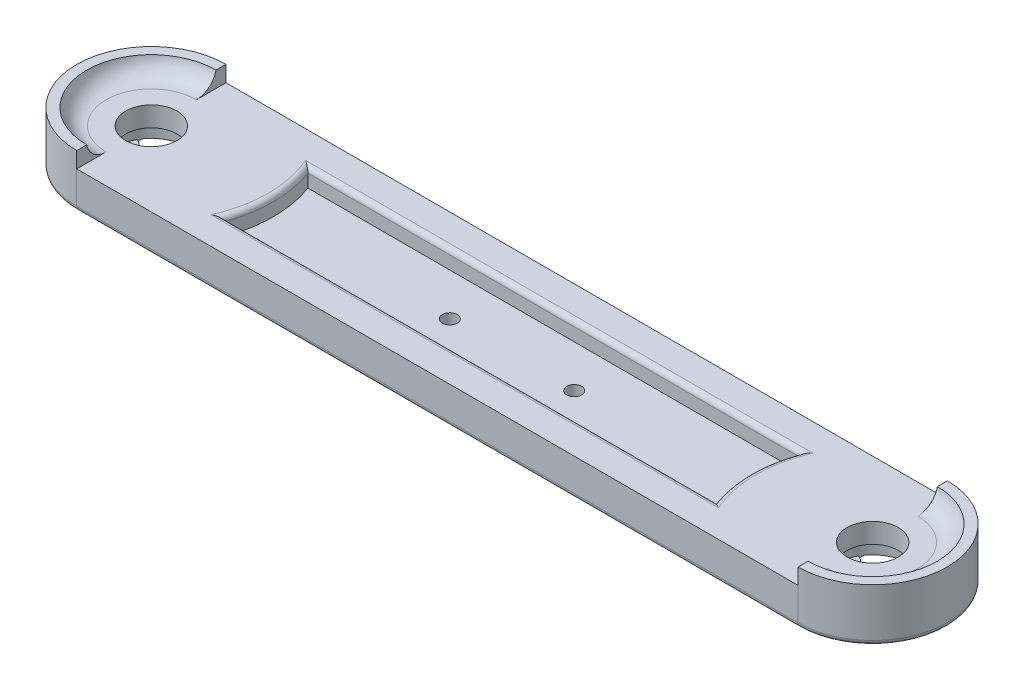
from build123d import *

# Parameters (mm, degrees)
CROQUIS1_R              = 15
CROQUIS1_R_2            = 5.15
SALIENTE_EXTRUIR1_DEPTH = 7.5
CROQUIS2_R              = 5.15
CORTAR_EXTRUIR1_DEPTH   = 3.5
SALIENTE_EXTRUIR6_DEPTH = 3.2
CROQUIS13_R             = 1.5
CORTAR_EXTRUIR2_DEPTH   = 3.6
REDONDEO1_R             = 4
REDONDEO2_R             = 1
REDONDEO3_R             = 1
SALIENTE_EXTRUIR7_START = 2
SALIENTE_EXTRUIR7_DEPTH = 2
REDONDEO5_R             = 1
CROQUIS13_2_R           = 1.5
CORTAR_EXTRUIR3_DEPTH   = 90.28325712


with BuildPart() as part:
    # Croquis1 → Saliente-Extruir1 (new body)
    # profile 1 of 3: a face of its own
    with BuildSketch(Plane(origin=(0, 0, 0), x_dir=(1, 0, 0), z_dir=(0, 1, 0))):
        with Locations((-72.5, 0)):
            Circle(CROQUIS1_R)
        with Locations(Location((-72.5, 0, 0), (0, 0, 270))):
            Circle(CROQUIS1_R_2, mode=Mode.SUBTRACT)
    # profile 2 of 3: a face of its own
    with BuildSketch(Plane(origin=(0, 0, 0), x_dir=(1, 0, 0), z_dir=(0, 1, 0))):
        with BuildLine():
            Line((72.5, 15), (-72.5, 15))
            ThreePointArc((-72.5, 15), (-61.893398282, 10.606601718), (-57.5, 0))
            ThreePointArc((-57.5, 0), (-61.893398282, -10.606601718), (-72.5, -15))
            Line((-72.5, -15), (72.5, -15))
            ThreePointArc((72.5, -15), (57.5, 0), (72.5, 15))
        make_face()
    # profile 3 of 3: a face of its own
    with BuildSketch(Plane(origin=(0, 0, 0), x_dir=(1, 0, 0), z_dir=(0, 1, 0))):
        with Locations((72.5, 0)):
            Circle(CROQUIS1_R)
        with Locations(Location((72.5, 0, 0), (0, 0, 270))):
            Circle(CROQUIS1_R_2, mode=Mode.SUBTRACT)
    extrude(amount=SALIENTE_EXTRUIR1_DEPTH)

    # Croquis2 → Cortar-Extruir1 (cut)
    with BuildSketch(Plane.XZ):
        with BuildLine():
            ThreePointArc((-72.5, -5.15), (-77.65, 0), (-72.5, 5.15))
            Line((-72.5, 5.15), (-72.5, 7.5))
            ThreePointArc((-72.5, 7.5), (-80, 0), (-72.5, -7.5))
            Line((-72.5, -7.5), (-72.5, -5.15))
        make_face()
        with BuildLine():
            Line((-72.5, 7.5), (-72.5, 5.15))
            ThreePointArc((-72.5, 5.15), (-68.858400077, 3.641599923), (-67.35, 0))
            ThreePointArc((-67.35, 0), (-68.858400077, -3.641599923), (-72.5, -5.15))
            Line((-72.5, -5.15), (-72.5, -7.5))
            ThreePointArc((-72.5, -7.5), (-65, 0), (-72.5, 7.5))
        make_face()
        with BuildLine():
            Line((72.5, -7.5), (72.5, -5.15))
            ThreePointArc((72.5, -5.15), (67.35, 0), (72.5, 5.15))
            Line((72.5, 5.15), (72.5, 7.5))
            ThreePointArc((72.5, 7.5), (65, 0), (72.5, -7.5))
        make_face()
        with BuildLine():
            ThreePointArc((77.65, 0), (76.141599923, -3.641599923), (72.5, -5.15))
            Line((72.5, -5.15), (72.5, -7.5))
            ThreePointArc((72.5, -7.5), (80, 0), (72.5, 7.5))
            Line((72.5, 7.5), (72.5, 5.15))
            ThreePointArc((72.5, 5.15), (76.141599923, 3.641599923), (77.65, 0))
        make_face()
        with Locations(Location((72.5, 0, 0), (0, 0, 270))):
            Circle(CROQUIS2_R)
    extrude(amount=-CORTAR_EXTRUIR1_DEPTH, mode=Mode.SUBTRACT)

    # Croquis9 → Saliente-Extruir6 (add)
    with BuildSketch(Plane(origin=(0, 7.5, 0), x_dir=(1, 0, 0), z_dir=(0, 1, 0))):
        with BuildLine():
            Line((-72.5, 15), (-72.5, 13))
            ThreePointArc((-72.5, 13), (-85.5, 0), (-72.5, -13))
            Line((-72.5, -13), (-72.5, -15))
            ThreePointArc((-72.5, -15), (-87.5, 0), (-72.5, 15))
        make_face()
        with BuildLine():
            Line((72.5, 15), (72.5, 13))
            ThreePointArc((72.5, 13), (85.5, 0), (72.5, -13))
            Line((72.5, -13), (72.5, -15))
            ThreePointArc((72.5, -15), (87.5, 0), (72.5, 15))
        make_face()
    extrude(amount=SALIENTE_EXTRUIR6_DEPTH)

    # Croquis13 → Cortar-Extruir2 (cut)
    with BuildSketch(Plane(origin=(0, 7.5, 0), x_dir=(1, 0, 0), z_dir=(0, 1, 0))):
        with BuildLine():
            Line((49.521749414, -8.5), (-49.521749414, -8.5))
            ThreePointArc((-49.521749414, -8.5), (-48, 0), (-49.521749414, 8.5))
            Line((-49.521749414, 8.5), (49.521749414, 8.5))
            ThreePointArc((49.521749414, 8.5), (48, 0), (49.521749414, -8.5))
        make_face()
        with Locations(Location((-12.5, 0, 0), (0, 0, 270))):
            Circle(CROQUIS13_R, mode=Mode.SUBTRACT)
        with Locations(Location((12.5, 0, 0), (0, 0, 90))):
            Circle(CROQUIS13_R, mode=Mode.SUBTRACT)
    extrude(amount=-CORTAR_EXTRUIR2_DEPTH, mode=Mode.SUBTRACT)

    # Redondeo1
    # the kernel refuses this fillet: 4 mm, written as the material it adds along each edge
    with BuildSketch(Plane(origin=(72.5, 7.5, 0), x_dir=(0, 0, -1), z_dir=(-1, 0, 0))) as redondeo1_piece_1:
        with BuildLine():
            CenterArc((9.080816412, -4), REDONDEO1_R, 11.536959033, 78.463040967)
            Line((13, -3.2), (13.078383672, -3.184))
            ThreePointArc((13.078383672, -3.184), (13.08, -1.6), (13.08, 0))
            Line((13.08, 0), (13, 0.08))
            Line((13, 0.08), (9.080816412, 0.08))
            Line((9.080816412, 0.08), (9.080816412, 0))
        make_face()
    revolve(axis=Axis((72.5, 7.5, 0), (0, -1, 0)), revolution_arc=180)
    with BuildSketch(Plane(origin=(-72.5, 7.5, 0), x_dir=(0, 0, -1), z_dir=(1, 0, 0))) as redondeo1_piece_2:
        with BuildLine():
            CenterArc((9.080816412, 4), REDONDEO1_R, 270, 78.463040967)
            Line((13, 3.2), (13.078383672, 3.184))
            ThreePointArc((13.078383672, 3.184), (13.08, 1.6), (13.08, 0))
            Line((13.08, 0), (13, -0.08))
            Line((13, -0.08), (9.080816412, -0.08))
            Line((9.080816412, -0.08), (9.080816412, 0))
        make_face()
    revolve(axis=Axis((-72.5, 7.5, 0), (0, 1, 0)), revolution_arc=180)

    # Redondeo2
    redondeo2_edges = [part.edges().sort_by_distance(p)[0] for p in [
        (-87.5, 0, 0),
        (0, 0, -15),
        (87.5, 0, 0),
        (0, 0, 15),
    ]]
    fillet(redondeo2_edges, radius=REDONDEO2_R)

    # Redondeo3
    redondeo3_edges = [part.edges().sort_by_distance(p)[0] for p in [
        (48, 7.5, 0),
        (0, 7.5, -8.5),
        (-48, 7.5, 0),
        (0, 7.5, 8.5),
    ]]
    fillet(redondeo3_edges, radius=REDONDEO3_R)

    # Croquis14 → Saliente-Extruir7 (add)
    with BuildSketch(Plane.XZ.offset(SALIENTE_EXTRUIR7_START)):
        with BuildLine():
            Line((-78.934449598, 3.602473326), (-81.185988533, 4.205771366))
            ThreePointArc((-81.185988533, 4.205771366), (-82.2614458, 0), (-81.185988533, -4.205771366))
            Line((-81.185988533, -4.205771366), (-78.934449598, -3.602473326))
            ThreePointArc((-78.934449598, -3.602473326), (-77.733165492, -2.693023984), (-77.507447775, -1.203314912))
            ThreePointArc((-77.507447775, -1.203314912), (-77.65, 0), (-77.507447775, 1.203314912))
            ThreePointArc((-77.507447775, 1.203314912), (-77.733165492, 2.693023984), (-78.934449598, 3.602473326))
        make_face()
        with BuildLine():
            Line((-66.065550402, -3.602473326), (-63.814011467, -4.205771366))
            ThreePointArc((-63.814011467, -4.205771366), (-62.7385542, 0), (-63.814011467, 4.205771366))
            Line((-63.814011467, 4.205771366), (-66.065550402, 3.602473326))
            ThreePointArc((-66.065550402, 3.602473326), (-67.266834508, 2.693023984), (-67.492552225, 1.203314912))
            ThreePointArc((-67.492552225, 1.203314912), (-67.35, 0), (-67.492552225, -1.203314912))
            ThreePointArc((-67.492552225, -1.203314912), (-67.266834508, -2.693023984), (-66.065550402, -3.602473326))
        make_face()
    extrude(amount=-SALIENTE_EXTRUIR7_DEPTH)

    # Redondeo5
    # the kernel refuses this fillet: 1 mm, written as the material it takes off along each edge
    with BuildSketch(Plane(origin=(-81.185988533, -4.193298446, 4.205771366), x_dir=(-0.435508259696017, 0, -0.9001847342276733), z_dir=(0, 1, 0)), Plane(origin=(-63.814011467, -4.193298446, -4.205771366), x_dir=(0.435508259696011, 0, 0.9001847342276761), z_dir=(0, 1, 0))) as redondeo5_piece_1:
        with BuildLine():
            CenterArc((0.827252335, -0.998745859), REDONDEO5_R, 87.130169883, 82.052190477)
            Line((-0.15497718, -0.811062137), (0, 0))
            ThreePointArc((0, 0), (0.438659689, 0.010988087), (0.877319378, 0))
        make_face()
    extrude(amount=4.193298446, mode=Mode.SUBTRACT)
    with BuildSketch(Plane(origin=(-81.185988533, -4.193298446, -4.205771366), x_dir=(0.9659258262890669, 0, 0.2588190451025264), z_dir=(0, 1, 0)), Plane(origin=(-63.814011467, -4.193298446, 4.205771366), x_dir=(-0.9659258262890679, 0, -0.2588190451025224), z_dir=(0, 1, 0))) as redondeo5_piece_2:
        with BuildLine():
            CenterArc((0.825735864, -1), REDONDEO5_R, 90, 82.052190477)
            ThreePointArc((-0.164658567, -0.861728988), (-0.093122107, -0.428802209), (0, 0))
            Line((0, 0), (0.825735864, 0))
        make_face()
    extrude(amount=4.193298446, mode=Mode.SUBTRACT)
    with BuildSketch(Plane(origin=(-73.5, -2, 0), x_dir=(-0.7066256100563062, 0, 0.7075876251126452), z_dir=(0.7075876251126452, 0, 0.7066256100563062))) as redondeo5_piece_3:
        with BuildLine():
            CenterArc((8.7614458 - REDONDEO5_R, -REDONDEO5_R), REDONDEO5_R, 0, 90)
            Line((8.7614458 - REDONDEO5_R, 0), (8.7614458, 0))
            Line((8.7614458, 0), (8.7614458, -REDONDEO5_R))
        make_face()
    revolve(axis=Axis((-73.5, -2, 0), (0, -1, 0)), revolution_arc=90.077950613, mode=Mode.SUBTRACT)
    with BuildSketch(Plane(origin=(-71.5, -2, 0), x_dir=(0.706625610056301, 0, -0.70758762511265), z_dir=(-0.70758762511265, 0, -0.706625610056301))) as redondeo5_piece_4:
        with BuildLine():
            CenterArc((8.7614458 - REDONDEO5_R, -REDONDEO5_R), REDONDEO5_R, 0, 90)
            Line((8.7614458 - REDONDEO5_R, 0), (8.7614458, 0))
            Line((8.7614458, 0), (8.7614458, -REDONDEO5_R))
        make_face()
    revolve(axis=Axis((-71.5, -2, 0), (0, -1, 0)), revolution_arc=90.077950613, mode=Mode.SUBTRACT)
    # the kernel refuses this fillet: 1 mm, written as the material it adds along each edge
    with BuildSketch(Plane(origin=(-73.5, 0, 0), x_dir=(-0.920860386806379, 0, 0.38989248262925785), z_dir=(0.38989248262925785, 0, 0.920860386806379))) as redondeo5_2_piece_1:
        with BuildLine():
            CenterArc((8.7614458 + REDONDEO5_R, REDONDEO5_R), REDONDEO5_R, 180, 90)
            Line((8.7614458, REDONDEO5_R), (8.7614458, 0))
            Line((8.7614458, 0), (8.7614458 + REDONDEO5_R, 0))
        make_face()
    revolve(axis=Axis((-73.5, 0, 0), (0, -1, 0)), revolution_arc=45.895619046)
    with BuildSketch(Plane(origin=(-80.388388937, 0, -3.992055198), x_dir=(0.2588190451025228, 0, -0.9659258262890676), z_dir=(0.9659258262890678, 0, 0.25881904510252285))) as redondeo5_2_piece_2_section:
        with BuildLine():
            CenterArc((REDONDEO5_R, -REDONDEO5_R), REDONDEO5_R, 90, 90)
            Line((0, -REDONDEO5_R), (0, 0))
            Line((0, 0), (REDONDEO5_R, 0))
        make_face()
    redondeo5_2_piece_2 = extrude(amount=3.87558803, mode=Mode.PRIVATE)
    redondeo5_2_piece_2 = redondeo5_2_piece_2 - Plane(origin=(-72.5, 0, 0), x_dir=(0, 0, 1), z_dir=(0, -1, 0)) * Cylinder(7.5, 12, mode=Mode.PRIVATE)
    add(redondeo5_2_piece_2)
    with BuildSketch(Plane(origin=(-76.644858367, 0, 2.988979205), x_dir=(0.25881904510252285, 0, 0.9659258262890678), z_dir=(-0.9659258262890678, 0, 0.25881904510252285))) as redondeo5_2_piece_3_section:
        with BuildLine():
            CenterArc((REDONDEO5_R, -REDONDEO5_R), REDONDEO5_R, 90, 90)
            Line((0, -REDONDEO5_R), (0, 0))
            Line((0, 0), (REDONDEO5_R, 0))
        make_face()
    redondeo5_2_piece_3 = extrude(amount=3.87558803, mode=Mode.PRIVATE)
    redondeo5_2_piece_3 = redondeo5_2_piece_3 - Plane(origin=(-72.5, 0, 0), x_dir=(0, 0, 1), z_dir=(0, -1, 0)) * Cylinder(7.5, 12, mode=Mode.PRIVATE)
    add(redondeo5_2_piece_3)
    with BuildSketch(Plane(origin=(-68.355141633, 0, -2.988979205), x_dir=(-0.25881904510252285, 0, -0.9659258262890676), z_dir=(0.9659258262890678, 0, -0.25881904510252285))) as redondeo5_2_piece_4_section:
        with BuildLine():
            CenterArc((REDONDEO5_R, -REDONDEO5_R), REDONDEO5_R, 90, 90)
            Line((0, -REDONDEO5_R), (0, 0))
            Line((0, 0), (REDONDEO5_R, 0))
        make_face()
    redondeo5_2_piece_4 = extrude(amount=3.87558803, mode=Mode.PRIVATE)
    redondeo5_2_piece_4 = redondeo5_2_piece_4 - Plane(origin=(-72.5, 0, 0), x_dir=(0, 0, 1), z_dir=(0, -1, 0)) * Cylinder(7.5, 12, mode=Mode.PRIVATE)
    add(redondeo5_2_piece_4)
    with BuildSketch(Plane(origin=(-71.5, 0, 0), x_dir=(0.9208603868063772, 0, -0.38989248262926174), z_dir=(-0.38989248262926174, 0, -0.9208603868063772))) as redondeo5_2_piece_5:
        with BuildLine():
            CenterArc((8.7614458 + REDONDEO5_R, REDONDEO5_R), REDONDEO5_R, 180, 90)
            Line((8.7614458, REDONDEO5_R), (8.7614458, 0))
            Line((8.7614458, 0), (8.7614458 + REDONDEO5_R, 0))
        make_face()
    revolve(axis=Axis((-71.5, 0, 0), (0, -1, 0)), revolution_arc=45.895619046)
    with BuildSketch(Plane(origin=(-64.611611063, 0, 3.992055198), x_dir=(-0.2588190451025229, 0, 0.9659258262890679), z_dir=(-0.9659258262890678, 0, -0.25881904510252285))) as redondeo5_2_piece_6_section:
        with BuildLine():
            CenterArc((REDONDEO5_R, -REDONDEO5_R), REDONDEO5_R, 90, 90)
            Line((0, -REDONDEO5_R), (0, 0))
            Line((0, 0), (REDONDEO5_R, 0))
        make_face()
    redondeo5_2_piece_6 = extrude(amount=3.87558803, mode=Mode.PRIVATE)
    redondeo5_2_piece_6 = redondeo5_2_piece_6 - Plane(origin=(-72.5, 0, 0), x_dir=(0, 0, 1), z_dir=(0, -1, 0)) * Cylinder(7.5, 12, mode=Mode.PRIVATE)
    add(redondeo5_2_piece_6)
    with BuildSketch(Plane(origin=(-64.352792018, 0, 3.026129372), x_dir=(-0.2588190451025269, 0, 0.9659258262890666), z_dir=(-0.9659258262890666, 0, -0.2588190451025269))) as redondeo5_2_piece_7:
        with BuildLine():
            CenterArc((1 + REDONDEO5_R, -REDONDEO5_R), REDONDEO5_R, 90, 90)
            Line((1, -REDONDEO5_R), (1, 0))
            Line((1, 0), (1 + REDONDEO5_R, 0))
        make_face()
    revolve(axis=Axis((-64.352792018, 0, 3.026129372), (0, 1, 0)), revolution_arc=82.052190477)
    with BuildSketch(Plane(origin=(-64.352792018, 0, -3.026129372), x_dir=(0.920860386806377, 0, -0.38989248262926257), z_dir=(0.38989248262926257, 0, 0.920860386806377))) as redondeo5_2_piece_8:
        with BuildLine():
            CenterArc((1 + REDONDEO5_R, -REDONDEO5_R), REDONDEO5_R, 90, 90)
            Line((1, -REDONDEO5_R), (1, 0))
            Line((1, 0), (1 + REDONDEO5_R, 0))
        make_face()
    revolve(axis=Axis((-64.352792018, 0, -3.026129372), (0, 1, 0)), revolution_arc=82.052190477)
    with BuildSketch(Plane(origin=(-80.647207982, 0, 3.026129372), x_dir=(-0.9208603868063799, 0, 0.38989248262925547), z_dir=(-0.38989248262925547, 0, -0.9208603868063799))) as redondeo5_2_piece_9:
        with BuildLine():
            CenterArc((1 + REDONDEO5_R, -REDONDEO5_R), REDONDEO5_R, 90, 90)
            Line((1, -REDONDEO5_R), (1, 0))
            Line((1, 0), (1 + REDONDEO5_R, 0))
        make_face()
    revolve(axis=Axis((-80.647207982, 0, 3.026129372), (0, 1, 0)), revolution_arc=82.052190477)
    with BuildSketch(Plane(origin=(-80.647207982, 0, -3.026129372), x_dir=(0.2588190451025269, 0, -0.9659258262890666), z_dir=(0.9659258262890666, 0, 0.2588190451025269))) as redondeo5_2_piece_10:
        with BuildLine():
            CenterArc((1 + REDONDEO5_R, -REDONDEO5_R), REDONDEO5_R, 90, 90)
            Line((1, -REDONDEO5_R), (1, 0))
            Line((1, 0), (1 + REDONDEO5_R, 0))
        make_face()
    revolve(axis=Axis((-80.647207982, 0, -3.026129372), (0, 1, 0)), revolution_arc=82.052190477)

    # Simetría1: read off the stored shape, not the designer's step
    # Simetría1: part across plane


with BuildPart() as part_1:
    add(part.part)
    add(part.part.mirror(Plane(origin=(0, 0, 0), x_dir=(0, 0, 1), z_dir=(1, 0, 0))))

    # Croquis13<2> → Cortar-Extruir3 (cut, through all)
    with BuildSketch(Plane(origin=(0, 7.5, 0), x_dir=(1, 0, 0), z_dir=(0, 1, 0))):
        with Locations(Location((-12.5, 0, 0), (0, 0, 270))):
            Circle(CROQUIS13_2_R)
        with Locations(Location((12.5, 0, 0), (0, 0, 270))):
            Circle(CROQUIS13_2_R)
    extrude(amount=-CORTAR_EXTRUIR3_DEPTH, mode=Mode.SUBTRACT)


solid = part_1.part
